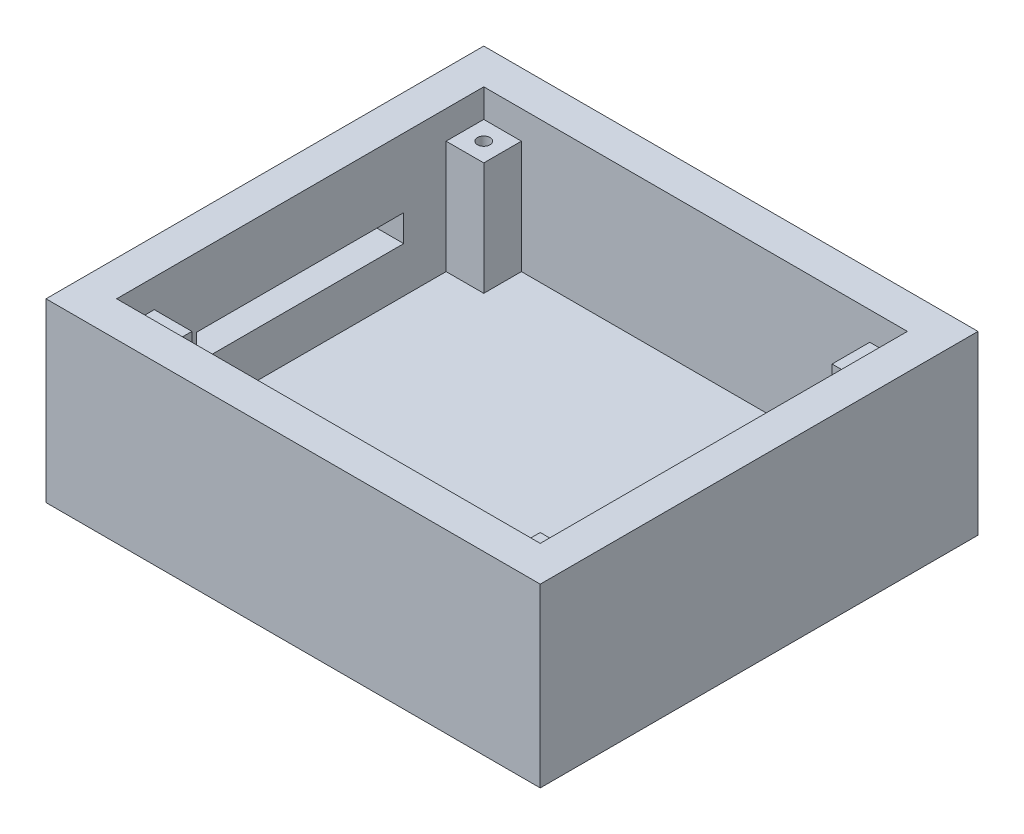
from build123d import *

# Parameters (mm, degrees)
SKETCH1_W           = 114.3
SKETCH1_H           = 99.06
BOSS_EXTRUDE1_DEPTH = 9.525
SKETCH1_3_W         = 133.35
SKETCH1_3_H         = 118.11
SKETCH1_3_W_2       = 114.3
SKETCH1_3_H_2       = 99.06
BOSS_EXTRUDE2_DEPTH = 47.625
SKETCH3_W           = 10.16
SKETCH3_H           = 10.16
SKETCH3_R           = 1.7018
BOSS_EXTRUDE3_DEPTH = 30.48
SKETCH5_W           = 55.88
SKETCH5_H           = 7.239
CUT_EXTRUDE1_DEPTH  = 30.48


with BuildPart() as part:
    # Sketch1 → Boss-Extrude1 (new body)
    with BuildSketch(Plane(origin=(0, 0, 0), x_dir=(1, 0, 0), z_dir=(0, 1, 0))):
        Rectangle(SKETCH1_W, SKETCH1_H)
    extrude(amount=BOSS_EXTRUDE1_DEPTH)

    # Sketch1<3> → Boss-Extrude2 (add)
    with BuildSketch(Plane(origin=(0, 0, 0), x_dir=(1, 0, 0), z_dir=(0, 1, 0))):
        Rectangle(SKETCH1_3_W, SKETCH1_3_H)
        Rectangle(SKETCH1_3_W_2, SKETCH1_3_H_2, mode=Mode.SUBTRACT)
    extrude(amount=BOSS_EXTRUDE2_DEPTH)

    # Sketch3 → Boss-Extrude3 (add)
    # profile 1 of 4: a face of its own
    with BuildSketch(Plane(origin=(0, 9.525, 0), x_dir=(1, 0, 0), z_dir=(0, 1, 0))):
        with Locations((-52.07, 44.45)):
            Rectangle(SKETCH3_W, SKETCH3_H)
        with Locations((-52.07, 44.45)):
            Circle(SKETCH3_R, mode=Mode.SUBTRACT)
    # profile 2 of 4: a face of its own
    with BuildSketch(Plane(origin=(0, 9.525, 0), x_dir=(1, 0, 0), z_dir=(0, 1, 0))):
        with Locations((52.07, 44.45)):
            Rectangle(SKETCH3_W, SKETCH3_H)
        with Locations((52.07, 44.45)):
            Circle(SKETCH3_R, mode=Mode.SUBTRACT)
    # profile 3 of 4: a face of its own
    with BuildSketch(Plane(origin=(0, 9.525, 0), x_dir=(1, 0, 0), z_dir=(0, 1, 0))):
        with Locations((52.07, -44.45)):
            Rectangle(SKETCH3_W, SKETCH3_H)
        with Locations((52.07, -44.45)):
            Circle(SKETCH3_R, mode=Mode.SUBTRACT)
    # profile 4 of 4: a face of its own
    with BuildSketch(Plane(origin=(0, 9.525, 0), x_dir=(1, 0, 0), z_dir=(0, 1, 0))):
        with Locations((-52.07, -44.45)):
            Rectangle(SKETCH3_W, SKETCH3_H)
        with Locations((-52.07, -44.45)):
            Circle(SKETCH3_R, mode=Mode.SUBTRACT)
    extrude(amount=BOSS_EXTRUDE3_DEPTH)

    # Sketch5 → Cut-Extrude1 (cut)
    with BuildSketch(Plane.ZY.offset(66.675)):
        with Locations((0, 25.4)):
            Rectangle(SKETCH5_W, SKETCH5_H)
    extrude(amount=-CUT_EXTRUDE1_DEPTH, mode=Mode.SUBTRACT)


solid = part.part
